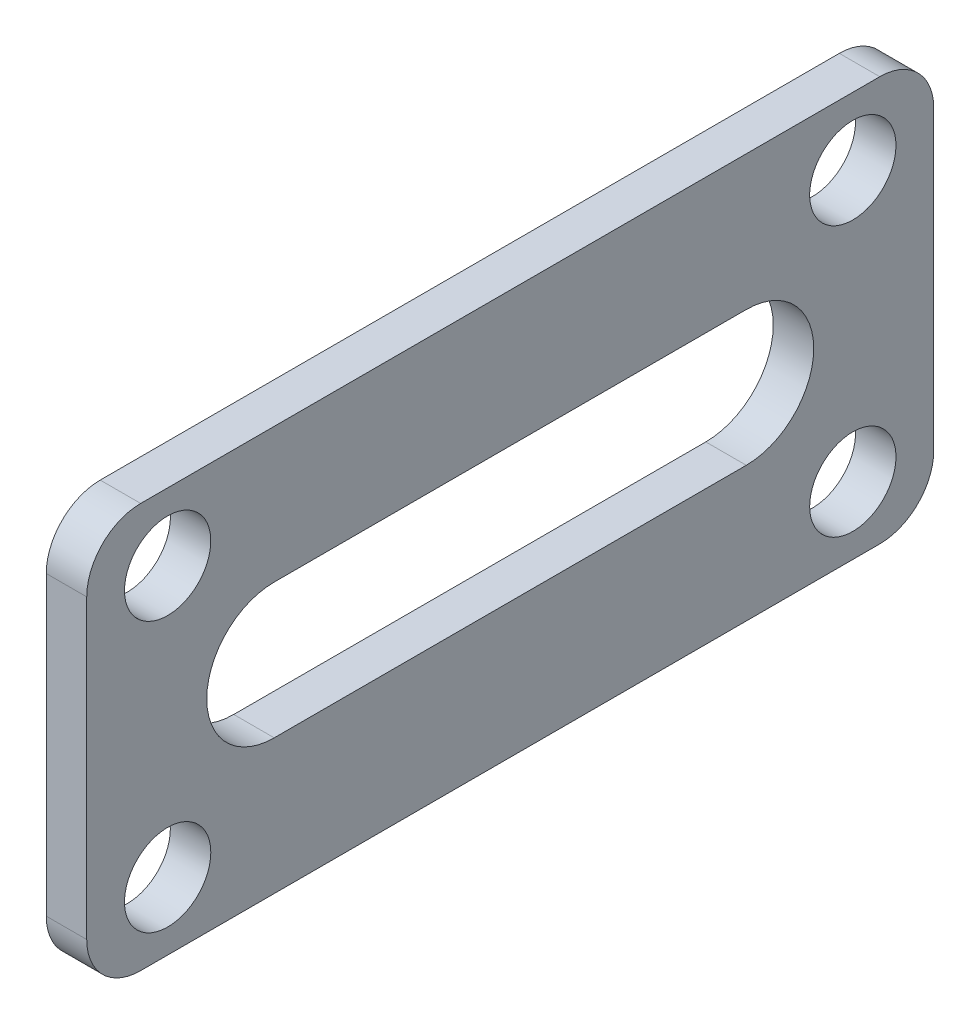
from build123d import *

# Parameters (mm, degrees)
SKETCH_1_W      = 31.4
SKETCH_1_H      = 15
SKETCH_1_R      = 1.6
EXTRUDE_1_DEPTH = 1.5
FILLET_1_R      = 2


with BuildPart() as part:
    # ｽｹｯﾁ1 → ﾎﾞｽ - 押し出し1 (new body)
    with BuildSketch(Plane(origin=(0, 0, 0), x_dir=(0, 0, -1), z_dir=(1, 0, 0))):
        Rectangle(SKETCH_1_W, SKETCH_1_H)
        with Locations((12.7, 5)):
            Circle(SKETCH_1_R, mode=Mode.SUBTRACT)
        with Locations((12.7, -5)):
            Circle(SKETCH_1_R, mode=Mode.SUBTRACT)
        with Locations((-12.7, 5)):
            Circle(SKETCH_1_R, mode=Mode.SUBTRACT)
        with Locations((-12.7, -5)):
            Circle(SKETCH_1_R, mode=Mode.SUBTRACT)
        with BuildLine():
            Line((-8.75, 2.5), (8.75, 2.5))
            ThreePointArc((8.75, 2.5), (11.25, 0), (8.75, -2.5))
            Line((8.75, -2.5), (-8.75, -2.5))
            ThreePointArc((-8.75, -2.5), (-11.25, 0), (-8.75, 2.5))
        make_face(mode=Mode.SUBTRACT)
    extrude(amount=EXTRUDE_1_DEPTH)

    # ﾌｨﾚｯﾄ1
    fillet_1_edges = [part.edges().sort_by_distance(p)[0] for p in [
        (0.75, -7.5, -15.7),
        (0.75, 7.5, -15.7),
        (0.75, -7.5, 15.7),
        (0.75, 7.5, 15.7),
    ]]
    fillet(fillet_1_edges, radius=FILLET_1_R)


solid = part.part
